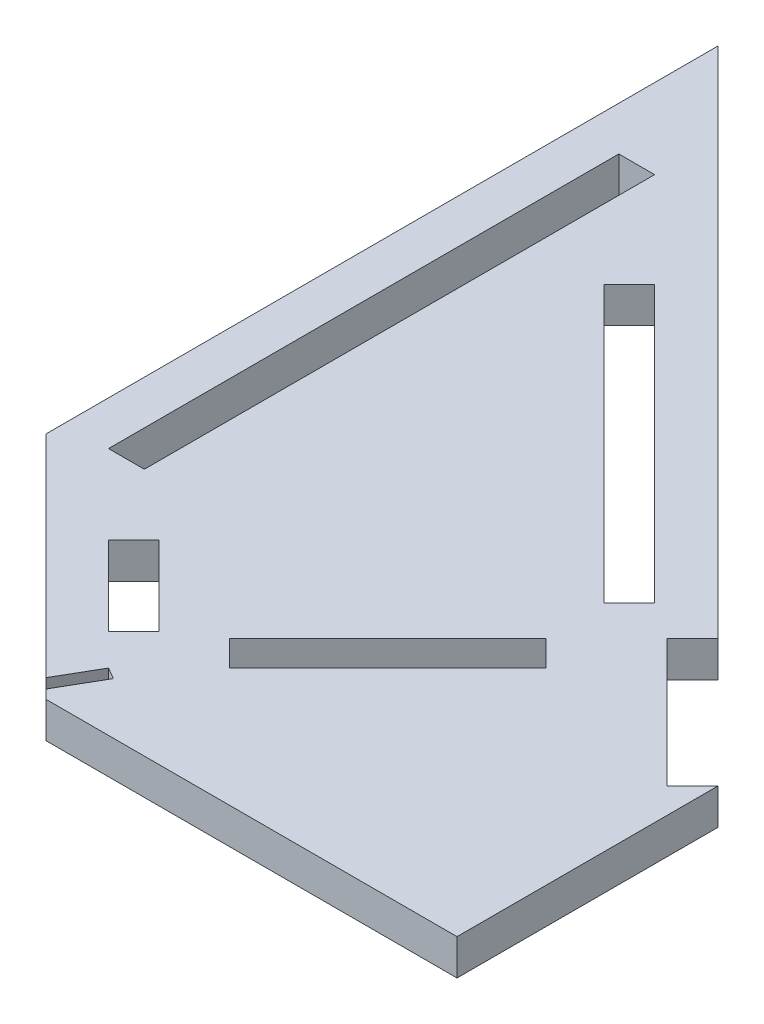
from build123d import *

# Parameters (mm, degrees)
SKETCH1_W           = 8
SKETCH1_H           = 113.93
BOSS_EXTRUDE1_DEPTH = 8


with BuildPart() as part:
    # Sketch1 → Boss-Extrude1 (new body)
    with BuildSketch(Plane(origin=(0, 0, 0), x_dir=(1, 0, 0), z_dir=(0, 1, 0))):
        Polygon((-91.75, 0), (0, 0), (0, 58.25), (-143.078881246, 201.328881246), (-143.078881246, 51.328881246), (-95.946152423, 4.196152423), (-90.845299457, 13.031088922), (-88.247223245, 11.531088922), (-93.75, 2), align=None)
        Polygon((-97.916367253, 20.10215676), (-115.594036783, 37.77982629), (-109.937182534, 43.436680539), (-92.259513004, 25.75901101), align=None, mode=Mode.SUBTRACT)
        Polygon((-77.336024402, 26.540363977), (-82.992878652, 32.197218226), (-47.637539592, 67.552557285), (-41.980685343, 61.895703036), align=None, mode=Mode.SUBTRACT)
        with Locations((-129.271706328, 112.422495793)):
            Rectangle(SKETCH1_W, SKETCH1_H, mode=Mode.SUBTRACT)
        Polygon((-48.083930093, 80.88601106), (-109.715357142, 142.517438108), (-104.058502892, 148.174292358), (-42.427075844, 86.542865309), align=None, mode=Mode.SUBTRACT)
        Polygon((-5.660145527, 52.593713329), (-34.128264538, 81.06183234), (-28.471410288, 86.718686589), (-0.003291278, 58.250567579), align=None, mode=Mode.SUBTRACT)
    extrude(amount=BOSS_EXTRUDE1_DEPTH)


solid = part.part
